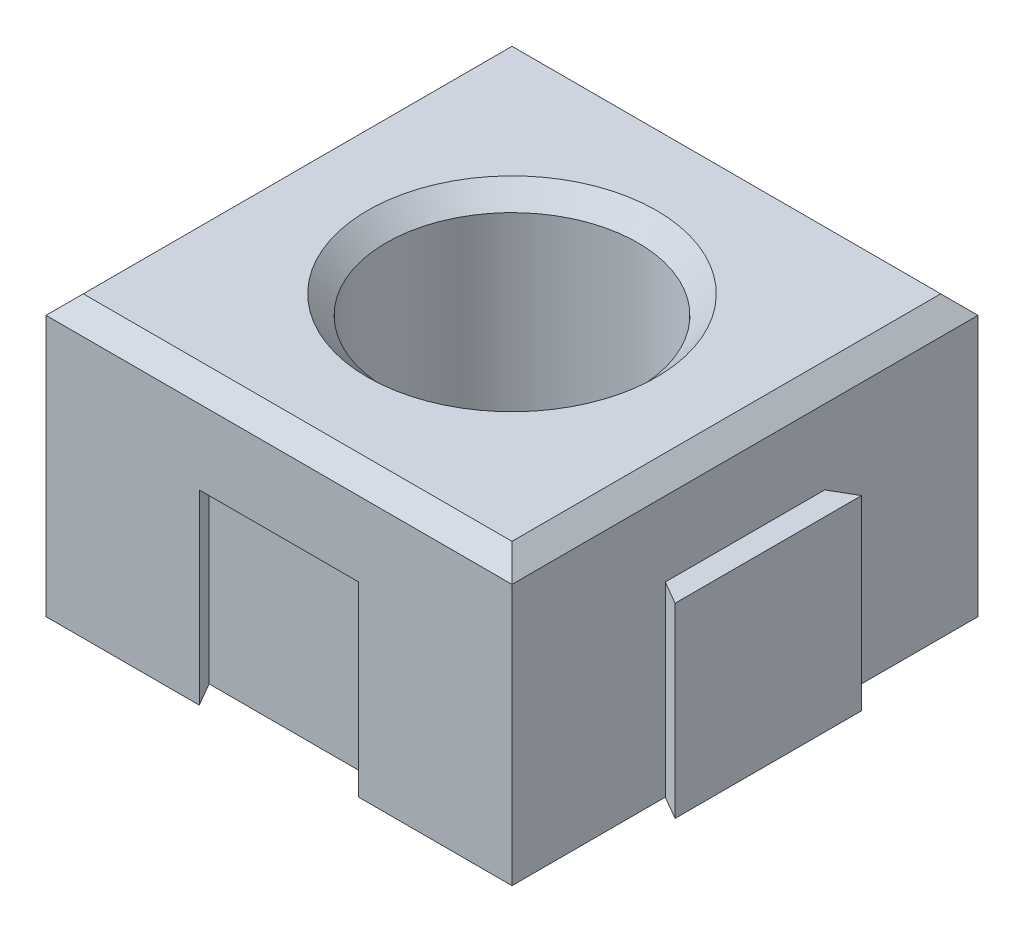
from build123d import *

# Parameters (mm, degrees)
SKETCH1_W           = 50
SKETCH1_H           = 50
BOSS_EXTRUDE1_DEPTH = 30
SKETCH2_R           = 13.5
CUT_EXTRUDE1_DEPTH  = 26
BOSS_EXTRUDE2_DEPTH = 20
BOSS_EXTRUDE3_DEPTH = 20
CUT_EXTRUDE2_DEPTH  = 20
CUT_EXTRUDE3_DEPTH  = 20
CHAMFER1_SIZE       = 2


with BuildPart() as part:
    # Sketch1 → Boss-Extrude1 (new body)
    with BuildSketch(Plane(origin=(0, 0, 0), x_dir=(1, 0, 0), z_dir=(0, 1, 0))):
        with Locations((25, 25)):
            Rectangle(SKETCH1_W, SKETCH1_H)
    extrude(amount=BOSS_EXTRUDE1_DEPTH)

    # Sketch2 → Cut-Extrude1 (cut)
    with BuildSketch(Plane(origin=(0, 30, 0), x_dir=(1, 0, 0), z_dir=(0, 1, 0))):
        with Locations((25, 25)):
            Circle(SKETCH2_R)
    extrude(amount=-CUT_EXTRUDE1_DEPTH, mode=Mode.SUBTRACT)

    # Sketch3 → Boss-Extrude2 (add)
    with BuildSketch(Plane(origin=(0, 0, 0), x_dir=(1, 0, 0), z_dir=(0, 1, 0))):
        Polygon((50, 33.556624327), (52.5, 35), (52.5, 15), (50, 16.443375673), align=None)
    extrude(amount=BOSS_EXTRUDE2_DEPTH)

    # Sketch3<3> → Boss-Extrude3 (add)
    with BuildSketch(Plane(origin=(0, 0, 0), x_dir=(1, 0, 0), z_dir=(0, 1, 0))):
        Polygon((16.443375673, 50), (15, 52.5), (35, 52.5), (33.556624327, 50), align=None)
    extrude(amount=BOSS_EXTRUDE3_DEPTH)

    # Sketch3<4> → Cut-Extrude2 (cut)
    with BuildSketch(Plane(origin=(0, 0, 0), x_dir=(1, 0, 0), z_dir=(0, 1, 0))):
        Polygon((0, 33.556624327), (2.5, 35), (2.5, 15), (0, 16.443375673), align=None)
    extrude(amount=CUT_EXTRUDE2_DEPTH, mode=Mode.SUBTRACT)

    # Sketch3<5> → Cut-Extrude3 (cut)
    with BuildSketch(Plane(origin=(0, 0, 0), x_dir=(1, 0, 0), z_dir=(0, 1, 0))):
        Polygon((16.443375673, 0), (15, 2.5), (35, 2.5), (33.556624327, 0), align=None)
    extrude(amount=CUT_EXTRUDE3_DEPTH, mode=Mode.SUBTRACT)

    # Chamfer1
    chamfer1_edges = [part.edges().sort_by_distance(p)[0] for p in [
        (25, 30, -50),
        (50, 30, -25),
        (25, 30, 0),
        (0, 30, -25),
        (11.5, 30, -25),
    ]]
    chamfer(chamfer1_edges, length=CHAMFER1_SIZE)


solid = part.part
